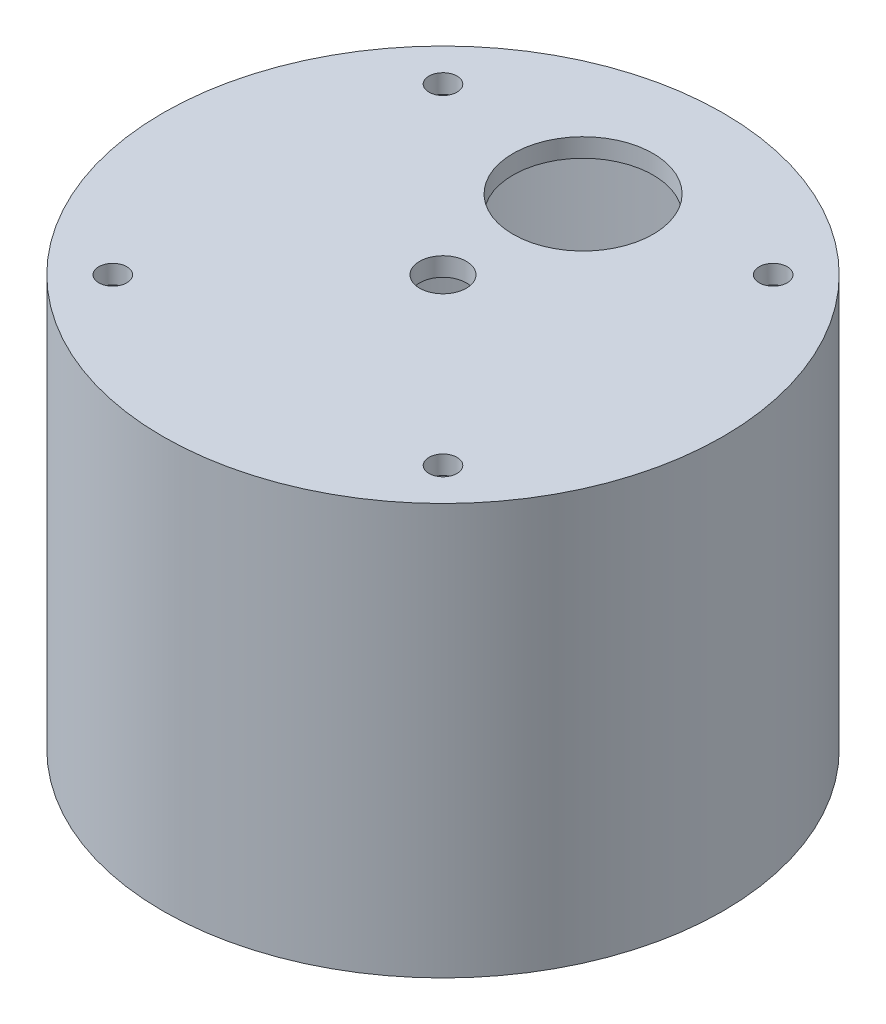
from build123d import *

# Parameters (mm, degrees)
SKETCH1_R           = 30
BOSS_EXTRUDE1_DEPTH = 2
SKETCH2_R           = 30
SKETCH2_R_2         = 29
BOSS_EXTRUDE2_DEPTH = 40
SKETCH3_R           = 30
BOSS_EXTRUDE3_DEPTH = 2
SKETCH4_R           = 7.5
CUT_EXTRUDE1_DEPTH  = 62.12282716
SKETCH8_R           = 1.5
CUT_EXTRUDE4_DEPTH  = 62.12282716
SKETCH9_R           = 2.5
CUT_EXTRUDE5_DEPTH  = 62.12282716


with BuildPart() as part:
    # Sketch1 → Boss-Extrude1 (new body)
    with BuildSketch(Plane(origin=(0, 0, 0), x_dir=(1, 0, 0), z_dir=(0, 1, 0))):
        Circle(SKETCH1_R)
    extrude(amount=BOSS_EXTRUDE1_DEPTH)

    # Sketch2 → Boss-Extrude2 (add)
    with BuildSketch(Plane(origin=(0, 2, 0), x_dir=(1, 0, 0), z_dir=(0, 1, 0))):
        Circle(SKETCH2_R)
        Circle(SKETCH2_R_2, mode=Mode.SUBTRACT)
    extrude(amount=BOSS_EXTRUDE2_DEPTH)

    # Sketch3 → Boss-Extrude3 (add)
    with BuildSketch(Plane(origin=(0, 42, 0), x_dir=(1, 0, 0), z_dir=(0, 1, 0))):
        Circle(SKETCH3_R)
    extrude(amount=BOSS_EXTRUDE3_DEPTH)

    # Sketch4 → Cut-Extrude1 (cut, through all)
    with BuildSketch(Plane(origin=(0, 44, 0), x_dir=(1, 0, 0), z_dir=(0, 1, 0))):
        with Locations((0, 15)):
            Circle(SKETCH4_R)
    extrude(amount=-CUT_EXTRUDE1_DEPTH, mode=Mode.SUBTRACT)

    # Sketch8 → Cut-Extrude4 (cut, through all)
    with BuildSketch(Plane(origin=(0, 44, 0), x_dir=(1, 0, 0), z_dir=(0, 1, 0))):
        with Locations((-17.67766953, 17.67766953)):
            Circle(SKETCH8_R)
        with Locations((17.67766953, -17.67766953)):
            Circle(SKETCH8_R)
        with Locations((17.67766953, 17.67766953)):
            Circle(SKETCH8_R)
        with Locations((-17.67766953, -17.67766953)):
            Circle(SKETCH8_R)
    extrude(amount=-CUT_EXTRUDE4_DEPTH, mode=Mode.SUBTRACT)

    # Sketch9 → Cut-Extrude5 (cut, through all)
    with BuildSketch(Plane(origin=(0, 44, 0), x_dir=(1, 0, 0), z_dir=(0, 1, 0))):
        Circle(SKETCH9_R)
    extrude(amount=-CUT_EXTRUDE5_DEPTH, mode=Mode.SUBTRACT)


solid = part.part
